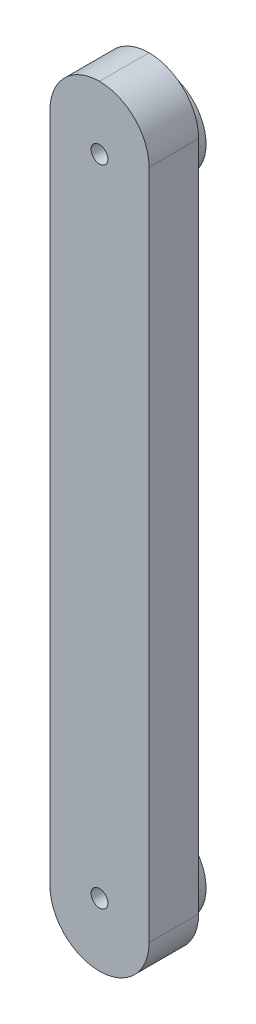
from build123d import *

# Parameters (mm, degrees)
SKETCH1_W           = 20
SKETCH1_H           = 155.5
BOSS_EXTRUDE1_DEPTH = 10
SKETCH2_R           = 9
BOSS_EXTRUDE2_DEPTH = 2.5
SKETCH3_R           = 1.7
CUT_EXTRUDE1_DEPTH  = 80.380806874
FILLET1_R           = 10


with BuildPart() as part:
    # Sketch1 → Boss-Extrude1 (new body)
    with BuildSketch(Plane.XY):
        Rectangle(SKETCH1_W, SKETCH1_H)
    extrude(amount=BOSS_EXTRUDE1_DEPTH)

    # Sketch2 → Boss-Extrude2 (add)
    with BuildSketch(Plane(origin=(0, 0, 0), x_dir=(-1, 0, 0), z_dir=(0, 0, -1))):
        with Locations(Location((0, 65, 0), (0, 0, 180))):
            Circle(SKETCH2_R)
        with Locations(Location((0, -65, 0), (0, 0, 180))):
            Circle(SKETCH2_R)
    extrude(amount=BOSS_EXTRUDE2_DEPTH)

    # Sketch3 → Cut-Extrude1 (cut, through all)
    with BuildSketch(Plane(origin=(0, 0, -2.5), x_dir=(-1, 0, 0), z_dir=(0, 0, -1))):
        with Locations((0, 65)):
            Circle(SKETCH3_R)
        with Locations((0, -65)):
            Circle(SKETCH3_R)
    extrude(amount=-CUT_EXTRUDE1_DEPTH, mode=Mode.SUBTRACT)

    # Fillet1
    fillet1_edges = [part.edges().sort_by_distance(p)[0] for p in [
        (10, -77.75, 5),
        (-10, -77.75, 5),
        (-10, 77.75, 5),
        (10, 77.75, 5),
    ]]
    fillet(fillet1_edges, radius=FILLET1_R - 0.0001)  # a hair under: the kernel refuses the full size


solid = part.part
